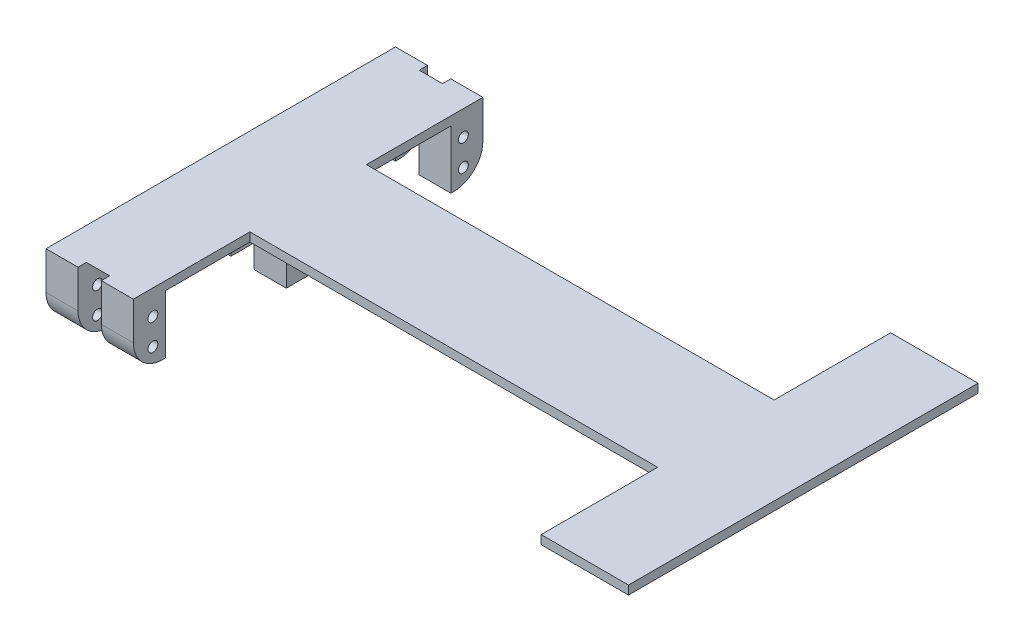
from build123d import *

# Parameters (mm, degrees)
EXTRUDE_1_DEPTH         = 3
SKETCH_3_W              = 11
SKETCH_3_H              = 7.5
SKETCH_3_H_2            = 11
SKETCH_3_H_3            = 15
EXTRUDE_3_DEPTH         = 20
HOLE_WIZARD_M3_1_REACH  = 211.762
HOLE_WIZARD_M3_1_BORE_R = 1.7
FILLET_1_R              = 10


with BuildPart() as part:
    # 스케치1 → 보스-돌출1 (new body)
    with BuildSketch(Plane(origin=(0, 0, 0), x_dir=(1, 0, 0), z_dir=(0, 1, 0))):
        Polygon((-100, 60), (-70, 60), (-70, 20), (70, 20), (70, 60), (100, 60), (100, -60), (70, -60), (70, -20), (-70, -20), (-70, -60), (-100, -60), align=None)
    extrude(amount=EXTRUDE_1_DEPTH)

    # 스케치3 → 보스-돌출3 (add)
    with BuildSketch(Plane.XZ):
        with Locations((-94.5, -3.75)):
            Rectangle(SKETCH_3_W, SKETCH_3_H)
        with Locations((-94.5, 3.75)):
            Rectangle(SKETCH_3_W, SKETCH_3_H)
        with Locations((-94.5, 54.5)):
            Rectangle(SKETCH_3_W, SKETCH_3_H_2)
        with Locations((-94.5, -54.5)):
            Rectangle(SKETCH_3_W, SKETCH_3_H_2)
        with Locations((-75.5, 54.5)):
            Rectangle(SKETCH_3_W, SKETCH_3_H_2)
        with Locations((-75.5, -54.5)):
            Rectangle(SKETCH_3_W, SKETCH_3_H_2)
        with Locations((-75.5, 0)):
            Rectangle(SKETCH_3_W, SKETCH_3_H_3)
    extrude(amount=EXTRUDE_3_DEPTH)

    # M3 여유 구멍1 bore → M3 여유 구멍1 (cut, up to next)
    with BuildSketch(Plane.ZY.offset(100), mode=Mode.PRIVATE) as hole_wizard_m3_1_sk1:
        with Locations((-3, -5.5)):
            Circle(HOLE_WIZARD_M3_1_BORE_R)
    hole_wizard_m3_1_tool1 = extrude(hole_wizard_m3_1_sk1.sketch, amount=-HOLE_WIZARD_M3_1_REACH, mode=Mode.PRIVATE) & part.part
    # M3 여유 구멍1 bore → M3 여유 구멍1 (cut, up to next)
    with BuildSketch(Plane.ZY.offset(100), mode=Mode.PRIVATE) as hole_wizard_m3_1_sk2:
        with Locations((-3, -14.5)):
            Circle(HOLE_WIZARD_M3_1_BORE_R)
    hole_wizard_m3_1_tool2 = extrude(hole_wizard_m3_1_sk2.sketch, amount=-HOLE_WIZARD_M3_1_REACH, mode=Mode.PRIVATE) & part.part
    # M3 여유 구멍1 bore → M3 여유 구멍1 (cut, up to next)
    with BuildSketch(Plane.ZY.offset(100), mode=Mode.PRIVATE) as hole_wizard_m3_1_sk3:
        with Locations((-53.3, -5.5)):
            Circle(HOLE_WIZARD_M3_1_BORE_R)
    hole_wizard_m3_1_tool3 = extrude(hole_wizard_m3_1_sk3.sketch, amount=-HOLE_WIZARD_M3_1_REACH, mode=Mode.PRIVATE) & part.part
    # M3 여유 구멍1 bore → M3 여유 구멍1 (cut, up to next)
    with BuildSketch(Plane.ZY.offset(100), mode=Mode.PRIVATE) as hole_wizard_m3_1_sk4:
        with Locations((-53.3, -14.5)):
            Circle(HOLE_WIZARD_M3_1_BORE_R)
    hole_wizard_m3_1_tool4 = extrude(hole_wizard_m3_1_sk4.sketch, amount=-HOLE_WIZARD_M3_1_REACH, mode=Mode.PRIVATE) & part.part
    # M3 여유 구멍1 bore → M3 여유 구멍1 (cut, up to next)
    with BuildSketch(Plane.ZY.offset(100), mode=Mode.PRIVATE) as hole_wizard_m3_1_sk5:
        with Locations((53.3, -5.5)):
            Circle(HOLE_WIZARD_M3_1_BORE_R)
    hole_wizard_m3_1_tool5 = extrude(hole_wizard_m3_1_sk5.sketch, amount=-HOLE_WIZARD_M3_1_REACH, mode=Mode.PRIVATE) & part.part
    # M3 여유 구멍1 bore → M3 여유 구멍1 (cut, up to next)
    with BuildSketch(Plane.ZY.offset(100), mode=Mode.PRIVATE) as hole_wizard_m3_1_sk6:
        with Locations((53.3, -14.5)):
            Circle(HOLE_WIZARD_M3_1_BORE_R)
    hole_wizard_m3_1_tool6 = extrude(hole_wizard_m3_1_sk6.sketch, amount=-HOLE_WIZARD_M3_1_REACH, mode=Mode.PRIVATE) & part.part
    # M3 여유 구멍1 bore → M3 여유 구멍1 (cut, up to next)
    with BuildSketch(Plane.ZY.offset(100), mode=Mode.PRIVATE) as hole_wizard_m3_1_sk7:
        with Locations((3, -14.5)):
            Circle(HOLE_WIZARD_M3_1_BORE_R)
    hole_wizard_m3_1_tool7 = extrude(hole_wizard_m3_1_sk7.sketch, amount=-HOLE_WIZARD_M3_1_REACH, mode=Mode.PRIVATE) & part.part
    # M3 여유 구멍1 bore → M3 여유 구멍1 (cut, up to next)
    with BuildSketch(Plane.ZY.offset(100), mode=Mode.PRIVATE) as hole_wizard_m3_1_sk8:
        with Locations((3, -5.5)):
            Circle(HOLE_WIZARD_M3_1_BORE_R)
    hole_wizard_m3_1_tool8 = extrude(hole_wizard_m3_1_sk8.sketch, amount=-HOLE_WIZARD_M3_1_REACH, mode=Mode.PRIVATE) & part.part
    hole_wizard_m3_1_1 = hole_wizard_m3_1_tool1.solids().sort_by_distance((-100, -5.5, -3))[0]
    add(hole_wizard_m3_1_1, mode=Mode.SUBTRACT)
    hole_wizard_m3_1_2 = hole_wizard_m3_1_tool2.solids().sort_by_distance((-100, -14.5, -3))[0]
    add(hole_wizard_m3_1_2, mode=Mode.SUBTRACT)
    hole_wizard_m3_1_3 = hole_wizard_m3_1_tool3.solids().sort_by_distance((-100, -5.5, -53.3))[0]
    add(hole_wizard_m3_1_3, mode=Mode.SUBTRACT)
    hole_wizard_m3_1_4 = hole_wizard_m3_1_tool4.solids().sort_by_distance((-100, -14.5, -53.3))[0]
    add(hole_wizard_m3_1_4, mode=Mode.SUBTRACT)
    hole_wizard_m3_1_5 = hole_wizard_m3_1_tool5.solids().sort_by_distance((-100, -5.5, 53.3))[0]
    add(hole_wizard_m3_1_5, mode=Mode.SUBTRACT)
    hole_wizard_m3_1_6 = hole_wizard_m3_1_tool6.solids().sort_by_distance((-100, -14.5, 53.3))[0]
    add(hole_wizard_m3_1_6, mode=Mode.SUBTRACT)
    hole_wizard_m3_1_7 = hole_wizard_m3_1_tool7.solids().sort_by_distance((-100, -14.5, 3))[0]
    add(hole_wizard_m3_1_7, mode=Mode.SUBTRACT)
    hole_wizard_m3_1_8 = hole_wizard_m3_1_tool8.solids().sort_by_distance((-100, -5.5, 3))[0]
    add(hole_wizard_m3_1_8, mode=Mode.SUBTRACT)
    hole_wizard_m3_1 = hole_wizard_m3_1_1 + hole_wizard_m3_1_2 + hole_wizard_m3_1_3 + hole_wizard_m3_1_4 + hole_wizard_m3_1_5 + hole_wizard_m3_1_6 + hole_wizard_m3_1_7 + hole_wizard_m3_1_8  # M3 여유 구멍1 as one shape, for the pattern or mirror that repeats it

    # 대칭 복사1: M3 여유 구멍1 mirrored; each copy of M3 여유 구멍1 runs up to whatever stops it at its own place
    mirror_1_before = part.part  # the part as the pattern finds it: every copy runs up to it
    mirror_1_hole_wizard_m3_1_long1 = extrude(hole_wizard_m3_1_sk1.sketch, amount=-HOLE_WIZARD_M3_1_REACH, mode=Mode.PRIVATE)
    mirror_1_hole_wizard_m3_1_long2 = extrude(hole_wizard_m3_1_sk2.sketch, amount=-HOLE_WIZARD_M3_1_REACH, mode=Mode.PRIVATE)
    mirror_1_hole_wizard_m3_1_long3 = extrude(hole_wizard_m3_1_sk3.sketch, amount=-HOLE_WIZARD_M3_1_REACH, mode=Mode.PRIVATE)
    mirror_1_hole_wizard_m3_1_long4 = extrude(hole_wizard_m3_1_sk4.sketch, amount=-HOLE_WIZARD_M3_1_REACH, mode=Mode.PRIVATE)
    mirror_1_hole_wizard_m3_1_long5 = extrude(hole_wizard_m3_1_sk5.sketch, amount=-HOLE_WIZARD_M3_1_REACH, mode=Mode.PRIVATE)
    mirror_1_hole_wizard_m3_1_long6 = extrude(hole_wizard_m3_1_sk6.sketch, amount=-HOLE_WIZARD_M3_1_REACH, mode=Mode.PRIVATE)
    mirror_1_hole_wizard_m3_1_long7 = extrude(hole_wizard_m3_1_sk7.sketch, amount=-HOLE_WIZARD_M3_1_REACH, mode=Mode.PRIVATE)
    mirror_1_hole_wizard_m3_1_long8 = extrude(hole_wizard_m3_1_sk8.sketch, amount=-HOLE_WIZARD_M3_1_REACH, mode=Mode.PRIVATE)
    mirror_1_hole_wizard_m3_1_tool1_1 = mirror_1_hole_wizard_m3_1_long1.mirror(Plane(origin=(0, 0, 0), x_dir=(0, 0, 1), z_dir=(1, 0, 0))) & mirror_1_before
    add(mirror_1_hole_wizard_m3_1_tool1_1.solids().sort_by_distance((100, -5.5, -3))[0], mode=Mode.SUBTRACT)
    mirror_1_hole_wizard_m3_1_tool2_1 = mirror_1_hole_wizard_m3_1_long2.mirror(Plane(origin=(0, 0, 0), x_dir=(0, 0, 1), z_dir=(1, 0, 0))) & mirror_1_before
    add(mirror_1_hole_wizard_m3_1_tool2_1.solids().sort_by_distance((100, -14.5, -3))[0], mode=Mode.SUBTRACT)
    mirror_1_hole_wizard_m3_1_tool3_1 = mirror_1_hole_wizard_m3_1_long3.mirror(Plane(origin=(0, 0, 0), x_dir=(0, 0, 1), z_dir=(1, 0, 0))) & mirror_1_before
    add(mirror_1_hole_wizard_m3_1_tool3_1.solids().sort_by_distance((100, -5.5, -53.3))[0], mode=Mode.SUBTRACT)
    mirror_1_hole_wizard_m3_1_tool4_1 = mirror_1_hole_wizard_m3_1_long4.mirror(Plane(origin=(0, 0, 0), x_dir=(0, 0, 1), z_dir=(1, 0, 0))) & mirror_1_before
    add(mirror_1_hole_wizard_m3_1_tool4_1.solids().sort_by_distance((100, -14.5, -53.3))[0], mode=Mode.SUBTRACT)
    mirror_1_hole_wizard_m3_1_tool5_1 = mirror_1_hole_wizard_m3_1_long5.mirror(Plane(origin=(0, 0, 0), x_dir=(0, 0, 1), z_dir=(1, 0, 0))) & mirror_1_before
    add(mirror_1_hole_wizard_m3_1_tool5_1.solids().sort_by_distance((100, -5.5, 53.3))[0], mode=Mode.SUBTRACT)
    mirror_1_hole_wizard_m3_1_tool6_1 = mirror_1_hole_wizard_m3_1_long6.mirror(Plane(origin=(0, 0, 0), x_dir=(0, 0, 1), z_dir=(1, 0, 0))) & mirror_1_before
    add(mirror_1_hole_wizard_m3_1_tool6_1.solids().sort_by_distance((100, -14.5, 53.3))[0], mode=Mode.SUBTRACT)
    mirror_1_hole_wizard_m3_1_tool7_1 = mirror_1_hole_wizard_m3_1_long7.mirror(Plane(origin=(0, 0, 0), x_dir=(0, 0, 1), z_dir=(1, 0, 0))) & mirror_1_before
    add(mirror_1_hole_wizard_m3_1_tool7_1.solids().sort_by_distance((100, -14.5, 3))[0], mode=Mode.SUBTRACT)
    mirror_1_hole_wizard_m3_1_tool8_1 = mirror_1_hole_wizard_m3_1_long8.mirror(Plane(origin=(0, 0, 0), x_dir=(0, 0, 1), z_dir=(1, 0, 0))) & mirror_1_before
    add(mirror_1_hole_wizard_m3_1_tool8_1.solids().sort_by_distance((100, -5.5, 3))[0], mode=Mode.SUBTRACT)

    # 필렛1
    # the kernel refuses this fillet: 10 mm, written as the material it takes off along each edge
    with BuildSketch(Plane(origin=(-81, 0, 60), x_dir=(0, 0, -1), z_dir=(-1, 0, 0))) as fillet_1_piece_1:
        with BuildLine():
            CenterArc((FILLET_1_R, -FILLET_1_R), FILLET_1_R, 90, 90)
            Line((0, -FILLET_1_R), (0, 0))
            Line((0, 0), (FILLET_1_R, 0))
        make_face()
    extrude(amount=8, mode=Mode.SUBTRACT)
    with BuildSketch(Plane(origin=(-64, -20, 60), x_dir=(0, 1, 0), z_dir=(-1, 0, 0)), Plane(origin=(-125, -20, -60), x_dir=(0, 1, 0), z_dir=(1, 0, 0)), Plane(origin=(-106, -20, -60), x_dir=(0, 1, 0), z_dir=(1, 0, 0))) as fillet_1_piece_2:
        with BuildLine():
            CenterArc((FILLET_1_R, FILLET_1_R), FILLET_1_R, 180, 90)
            Line((0, FILLET_1_R), (0, 0))
            Line((0, 0), (FILLET_1_R, 0))
        make_face()
    extrude(amount=61, mode=Mode.SUBTRACT)
    with BuildSketch(Plane(origin=(-106, -20, 60), x_dir=(0, 1, 0), z_dir=(1, 0, 0))) as fillet_1_piece_3:
        with BuildLine():
            CenterArc((FILLET_1_R, -FILLET_1_R), FILLET_1_R, 90, 90)
            Line((0, -FILLET_1_R), (0, 0))
            Line((0, 0), (FILLET_1_R, 0))
        make_face()
    extrude(amount=61, mode=Mode.SUBTRACT)
    with BuildSketch(Plane(origin=(-89, 0, -60), x_dir=(0, 1, 0), z_dir=(1, 0, 0))) as fillet_1_piece_4:
        with BuildLine():
            CenterArc((FILLET_1_R, FILLET_1_R), FILLET_1_R, 180, 90)
            Line((0, FILLET_1_R), (0, 0))
            Line((0, 0), (FILLET_1_R, 0))
        make_face()
    extrude(amount=8, mode=Mode.SUBTRACT)


solid = part.part
